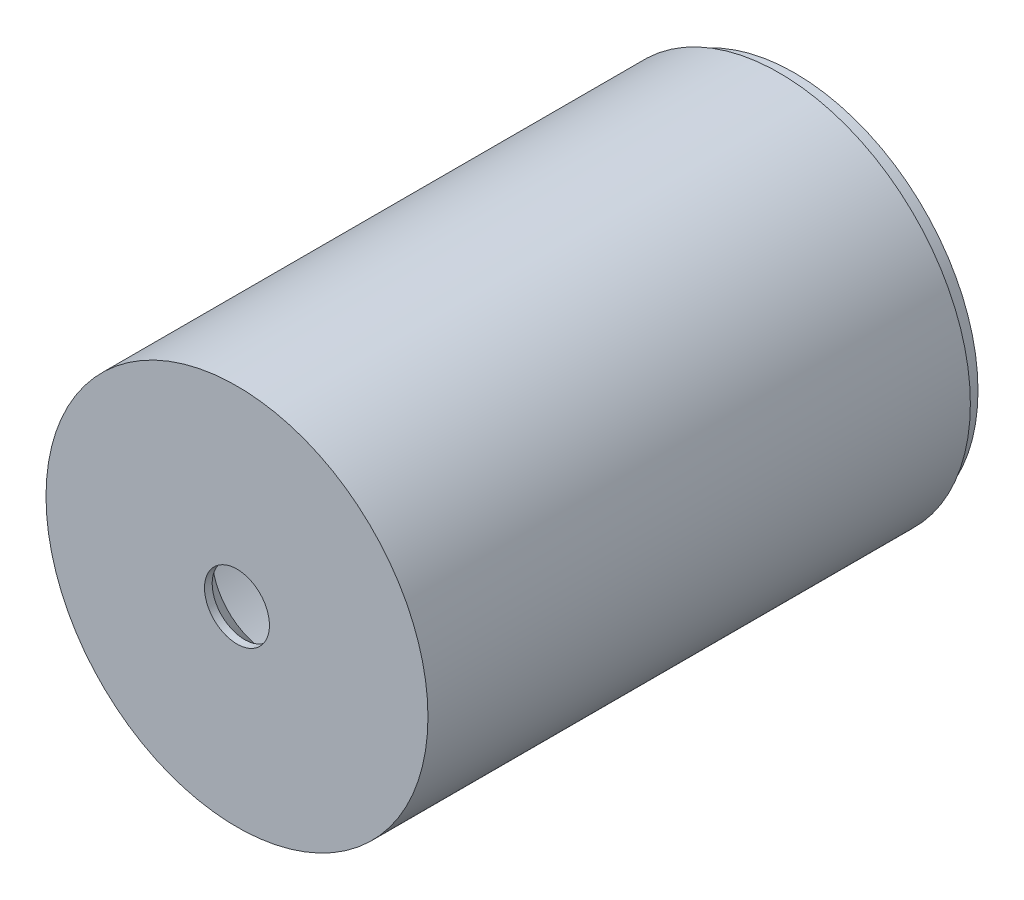
from build123d import *

# Parameters (mm, degrees)
SKETCH_1_R          = 2.5
SKETCH_1_R_2        = 2.3
EXTRUDE_1_DEPTH     = 6.3
SKETCH_2_R          = 2.5
EXTRUDE_2_DEPTH     = 1
SKETCH_4_R          = 0.425
CUT_EXTRUDE_1_DEPTH = 8.224264668
SKETCH_5_R          = 1.675
CUT_EXTRUDE_2_DEPTH = 0.6
SKETCH_6_R          = 2.2
CUT_EXTRUDE_3_DEPTH = 0.5
FILLET_1_R          = 0.1
FILLET_2_R          = 0.1
CHAMFER_2_SIZE      = 0.3
SKETCH_9_R          = 2.5
SKETCH_9_R_2        = 2.4
CUT_EXTRUDE_4_DEPTH = 0.2


with BuildPart() as part:
    # 스케치1 → 보스-돌출1 (new body)
    with BuildSketch(Plane.XY):
        Circle(SKETCH_1_R)
        Circle(SKETCH_1_R_2, mode=Mode.SUBTRACT)
    extrude(amount=EXTRUDE_1_DEPTH)

    # 스케치2 → 보스-돌출2 (add)
    with BuildSketch(Plane.XY.offset(6.3)):
        Circle(SKETCH_2_R)
    extrude(amount=EXTRUDE_2_DEPTH)

    # 스케치4 → 컷-돌출1 (cut, through all)
    with BuildSketch(Plane(origin=(0, 0, 6.3), x_dir=(-1, 0, 0), z_dir=(0, 0, -1))):
        Circle(SKETCH_4_R)
    extrude(amount=-CUT_EXTRUDE_1_DEPTH, mode=Mode.SUBTRACT)

    # 스케치5 → 컷-돌출2 (cut)
    with BuildSketch(Plane(origin=(0, 0, 6.3), x_dir=(-1, 0, 0), z_dir=(0, 0, -1))):
        Circle(SKETCH_5_R)
    extrude(amount=-CUT_EXTRUDE_2_DEPTH, mode=Mode.SUBTRACT)

    # 스케치6 → 컷-돌출3 (cut)
    with BuildSketch(Plane(origin=(0, 0, 6.3), x_dir=(-1, 0, 0), z_dir=(0, 0, -1))):
        Circle(SKETCH_6_R)
    extrude(amount=-CUT_EXTRUDE_3_DEPTH, mode=Mode.SUBTRACT)

    # 필렛1
    fillet_1_edges = [part.edges().sort_by_distance(p)[0] for p in [
        (2.2, 0, 6.3),
    ]]
    fillet(fillet_1_edges, radius=FILLET_1_R - 0.0001)  # a hair under: the kernel refuses the full size

    # 필렛2
    fillet_2_edges = [part.edges().sort_by_distance(p)[0] for p in [
        (1.675, 0, 6.8),
    ]]
    fillet(fillet_2_edges, radius=FILLET_2_R - 0.0001)  # a hair under: the kernel refuses the full size

    # 모따기2
    chamfer_2_edges = [part.edges().sort_by_distance(p)[0] for p in [
        (0.425, 0, 6.9),
    ]]
    chamfer(chamfer_2_edges, length=CHAMFER_2_SIZE)

    # 스케치9 → 컷-돌출4 (cut)
    with BuildSketch(Plane(origin=(0, 0, 0), x_dir=(-1, 0, 0), z_dir=(0, 0, -1))):
        Circle(SKETCH_9_R)
        Circle(SKETCH_9_R_2, mode=Mode.SUBTRACT)
    extrude(amount=-CUT_EXTRUDE_4_DEPTH, mode=Mode.SUBTRACT)


solid = part.part
